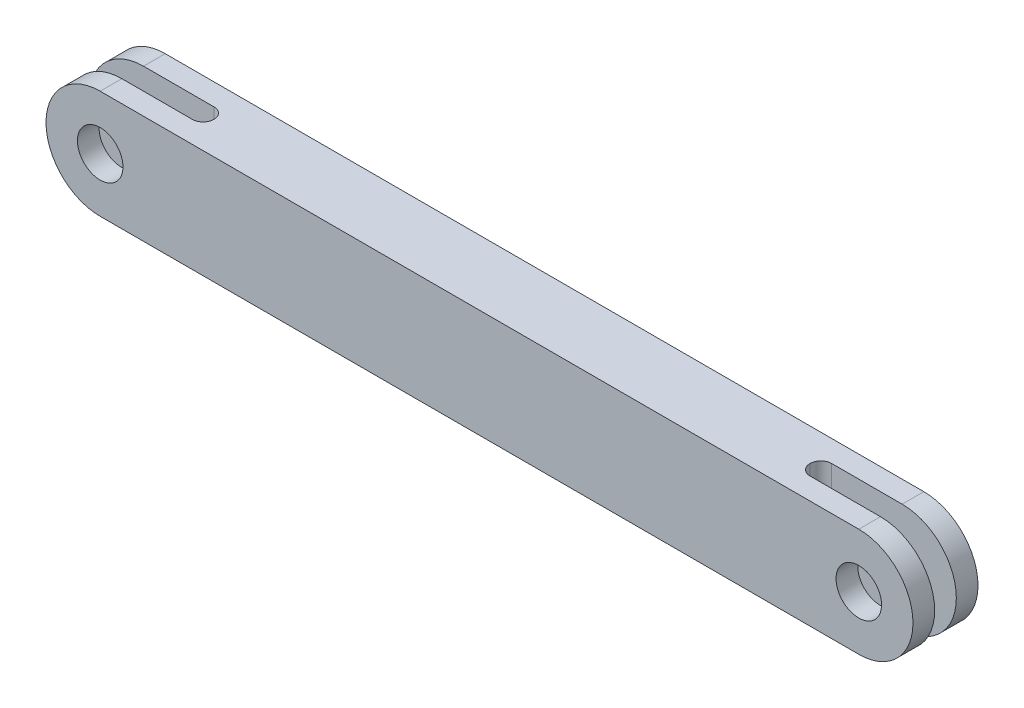
from build123d import *

# Parameters (mm, degrees)
BOSS_EXTRUDE1_DEPTH     = 6
SKETCH2_R               = 2.1
CUT_EXTRUDE1_DEPTH      = 41.755367745
CUT_EXTRUDE2_DEPTH      = 10
CUT_EXTRUDE2_DEPTH_BACK = 10
SKETCH3_W               = 25
SKETCH3_H               = 2
FILLET5_R               = 1


with BuildPart() as part:
    # Sketch1 → Boss-Extrude1 (new body)
    with BuildSketch(Plane.XY):
        with BuildLine():
            ThreePointArc((35, -5), (30, 0), (35, 5))
            Line((35, 5), (-35, 5))
            ThreePointArc((-35, 5), (-31.464466094, 3.535533906), (-30, 0))
            ThreePointArc((-30, 0), (-31.464466094, -3.535533906), (-35, -5))
            Line((-35, -5), (35, -5))
        make_face()
        with BuildLine():
            ThreePointArc((-30, 0), (-31.464466094, 3.535533906), (-35, 5))
            ThreePointArc((-35, 5), (-40, 0), (-35, -5))
            ThreePointArc((-35, -5), (-31.464466094, -3.535533906), (-30, 0))
        make_face()
        with BuildLine():
            ThreePointArc((40, 0), (38.535533906, 3.535533906), (35, 5))
            ThreePointArc((35, 5), (30, 0), (35, -5))
            ThreePointArc((35, -5), (38.535533906, -3.535533906), (40, 0))
        make_face()
    extrude(amount=BOSS_EXTRUDE1_DEPTH)

    # Sketch2 → Cut-Extrude1 (cut, through all)
    with BuildSketch(Plane.XY.offset(6)):
        with Locations((-35, 0)):
            Circle(SKETCH2_R)
        with Locations(Location((35, 0, 0), (0, 0, 180))):
            Circle(SKETCH2_R)
    extrude(amount=-CUT_EXTRUDE1_DEPTH, mode=Mode.SUBTRACT)

    # Sketch3 → Cut-Extrude2 (cut, two sides: drawn at the far end of the back side and taken through both)
    with BuildSketch(Plane(origin=(0, 0, 0), x_dir=(1, 0, 0), z_dir=(0, 1, 0)).offset(-CUT_EXTRUDE2_DEPTH_BACK)):
        with Locations((-40, -3)):
            Rectangle(SKETCH3_W, SKETCH3_H)
        with Locations((40, -3)):
            Rectangle(SKETCH3_W, SKETCH3_H)
    extrude(amount=CUT_EXTRUDE2_DEPTH + CUT_EXTRUDE2_DEPTH_BACK, mode=Mode.SUBTRACT)

    # SurfaceCut1
    split(bisect_by=Plane.XY.offset(3), keep=Keep.BOTTOM)

    # Mirror12: part across plane


with BuildPart() as part_1:
    add(part.part)
    add(part.part.mirror(Plane.XY.offset(3)))

    # Fillet5
    fillet5_edges = [part_1.edges().sort_by_distance(p)[0] for p in [
        (-27.5, 0, 2),
        (27.5, 0, 2),
        (27.5, 0, 4),
        (-27.5, 0, 4),
    ]]
    fillet(fillet5_edges, radius=FILLET5_R - 0.0001)  # a hair under: the kernel refuses the full size


solid = part_1.part
